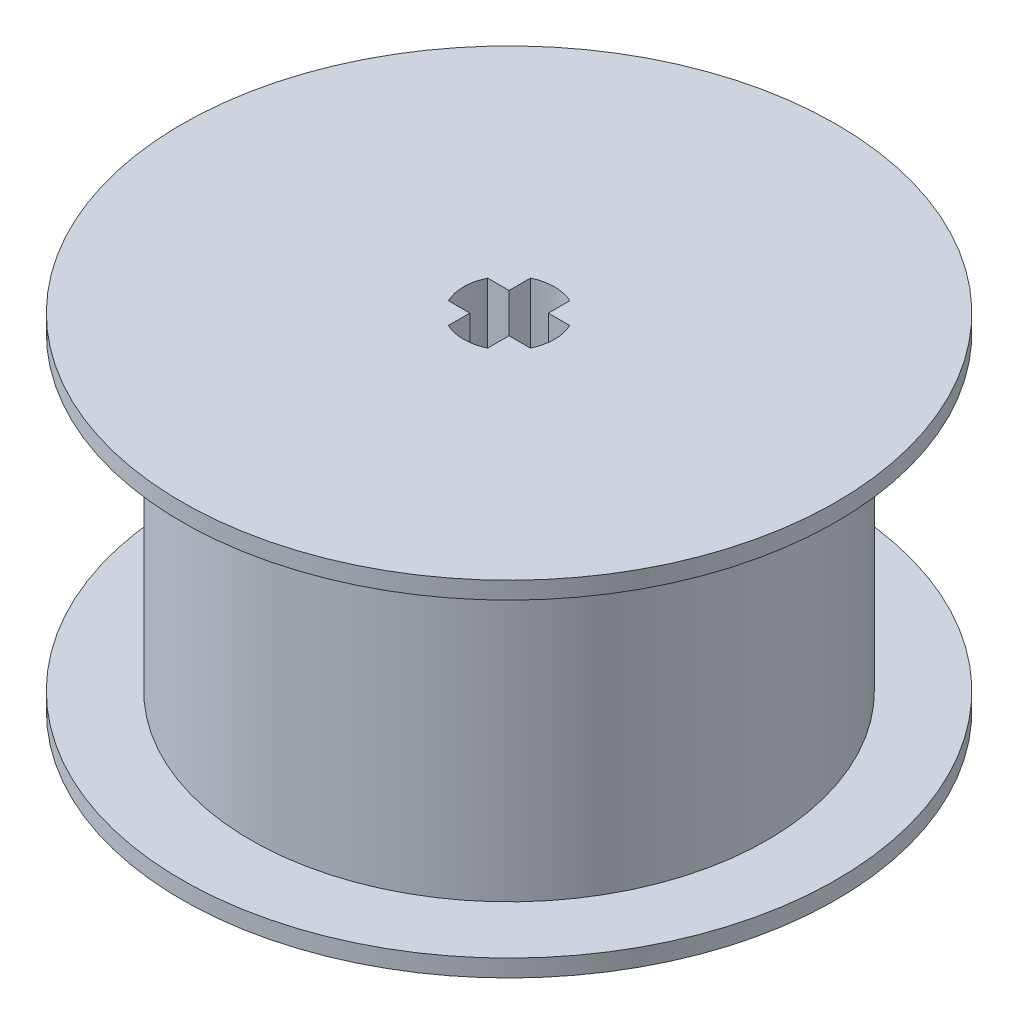
from build123d import *

# Parameters (mm, degrees)
CUT_EXTRUDE1_DEPTH      = 34.496268449
CUT_EXTRUDE2_DEPTH      = 34.496268449
CUT_EXTRUDE2_DEPTH_BACK = 34.496268449
SKETCH3_R               = 1.5


with BuildPart() as part:
    # Sketch2 → Revolve1 (revolve)
    with BuildSketch(Plane.XY):
        Polygon((0, 0), (19, 0), (19, -1), (15, -1), (15, -19), (19, -19), (19, -20), (0, -20), align=None)
    revolve(axis=Axis((0, 0, 0), (0, 1, 0)))

    # Sketch1 → Cut-Extrude1 (cut, through all)
    with BuildSketch(Plane(origin=(0, 0, 0), x_dir=(1, 0, 0), z_dir=(0, 1, 0))):
        with BuildLine():
            Line((-1.14, 1.14), (-2.38117618, 1.14))
            ThreePointArc((-2.38117618, 1.14), (-2.64, 0), (-2.38117618, -1.14))
            Line((-2.38117618, -1.14), (-1.14, -1.14))
            Line((-1.14, -1.14), (-1.14, -2.38117618))
            ThreePointArc((-1.14, -2.38117618), (0, -2.64), (1.14, -2.38117618))
            Line((1.14, -2.38117618), (1.14, -1.14))
            Line((1.14, -1.14), (2.38117618, -1.14))
            ThreePointArc((2.38117618, -1.14), (2.64, 0), (2.38117618, 1.14))
            Line((2.38117618, 1.14), (1.14, 1.14))
            Line((1.14, 1.14), (1.14, 2.38117618))
            ThreePointArc((1.14, 2.38117618), (0, 2.64), (-1.14, 2.38117618))
            Line((-1.14, 2.38117618), (-1.14, 1.14))
        make_face()
    extrude(amount=-CUT_EXTRUDE1_DEPTH, mode=Mode.SUBTRACT)

    # Sketch3 → Cut-Extrude2 (cut, two sides: drawn at the far end of the back side and taken through both)
    with BuildSketch(Plane(origin=(0, 0, 0), x_dir=(0, 0, -1), z_dir=(1, 0, 0)).offset(-CUT_EXTRUDE2_DEPTH_BACK)):
        with Locations((12, -10)):
            Circle(SKETCH3_R)
    extrude(amount=CUT_EXTRUDE2_DEPTH + CUT_EXTRUDE2_DEPTH_BACK, mode=Mode.SUBTRACT)


solid = part.part
